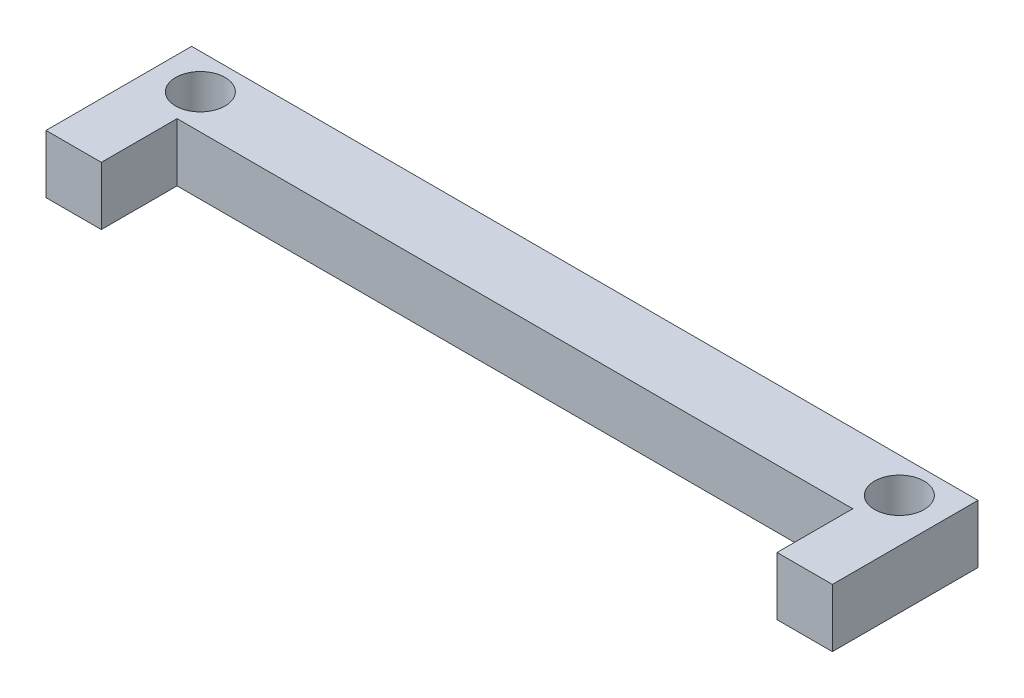
from build123d import *

# Parameters (mm, degrees)
SKETCH1_R           = 4.25
BOSS_EXTRUDE1_DEPTH = 10


with BuildPart() as part:
    # Sketch1 → Boss-Extrude1 (new body)
    with BuildSketch(Plane(origin=(0, 0, 0), x_dir=(1, 0, 0), z_dir=(0, 1, 0))):
        Polygon((-67.5, 12), (67.5, 12), (67.5, 0), (67.5, -13), (58, -13), (58, 0), (-58, 0), (-58, -13), (-67.5, -13), align=None)
        with Locations((-60, 6)):
            Circle(SKETCH1_R, mode=Mode.SUBTRACT)
        with Locations((60, 6)):
            Circle(SKETCH1_R, mode=Mode.SUBTRACT)
    extrude(amount=BOSS_EXTRUDE1_DEPTH)


solid = part.part
